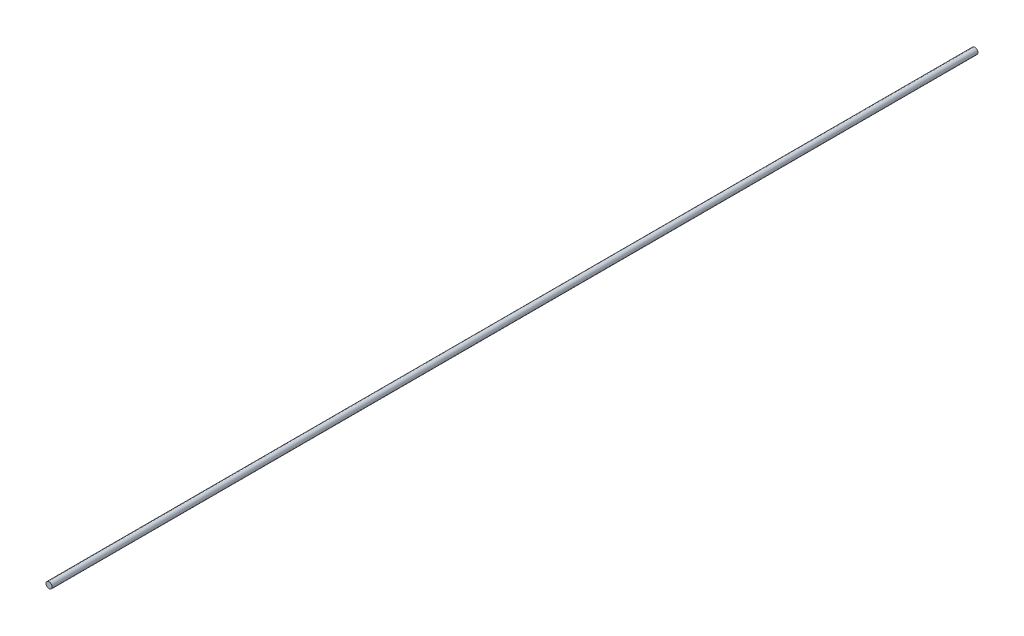
from build123d import *

# Parameters (mm, degrees)
SKETCH1_R = 2.5
ROD_DEPTH = 752


with BuildPart() as part:
    # Sketch1 → Rod (new body)
    with BuildSketch(Plane.XY):
        Circle(SKETCH1_R)
    extrude(amount=ROD_DEPTH)


solid = part.part
